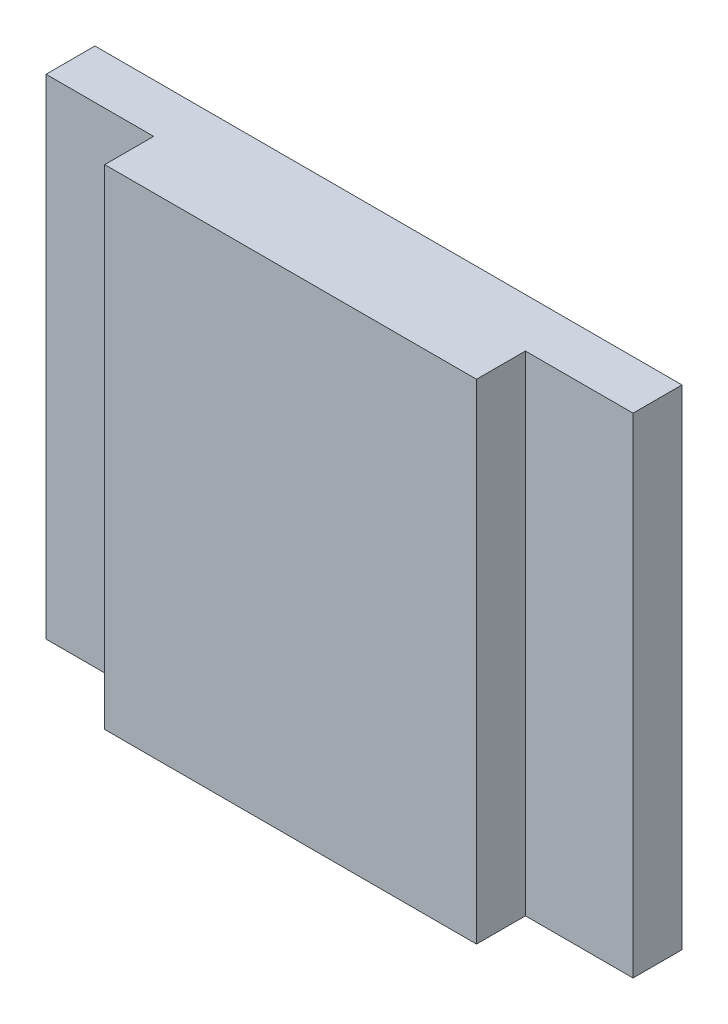
from build123d import *

# Parameters (mm, degrees)
BOSS_EXTRUDE1_DEPTH = 50
SKETCH2_R           = 2.5
CUT_EXTRUDE1_DEPTH  = 1


with BuildPart() as part:
    # Sketch1 → Boss-Extrude1 (new body)
    with BuildSketch(Plane(origin=(0, 0, 0), x_dir=(1, 0, 0), z_dir=(0, 1, 0))):
        Polygon((-25.087108014, 10.50174216), (34.912891986, 10.50174216), (34.912891986, 5.50174216), (23.912891986, 5.50174216), (23.912891986, 0.50174216), (-14.087108014, 0.50174216), (-14.087108014, 5.50174216), (-25.087108014, 5.50174216), align=None)
    extrude(amount=BOSS_EXTRUDE1_DEPTH)

    # Sketch2 → Cut-Extrude1 (cut)
    with BuildSketch(Plane(origin=(0, 0, -10.50174216), x_dir=(-1, 0, 0), z_dir=(0, 0, -1))):
        with Locations((-29.912891986, 40)):
            Circle(SKETCH2_R)
        with Locations((-29.912891986, 10)):
            Circle(SKETCH2_R)
        with Locations((20.087108014, 39.51671718)):
            Circle(SKETCH2_R)
        with Locations((20.087108014, 10)):
            Circle(SKETCH2_R)
    extrude(amount=-CUT_EXTRUDE1_DEPTH, mode=Mode.SUBTRACT)


solid = part.part
